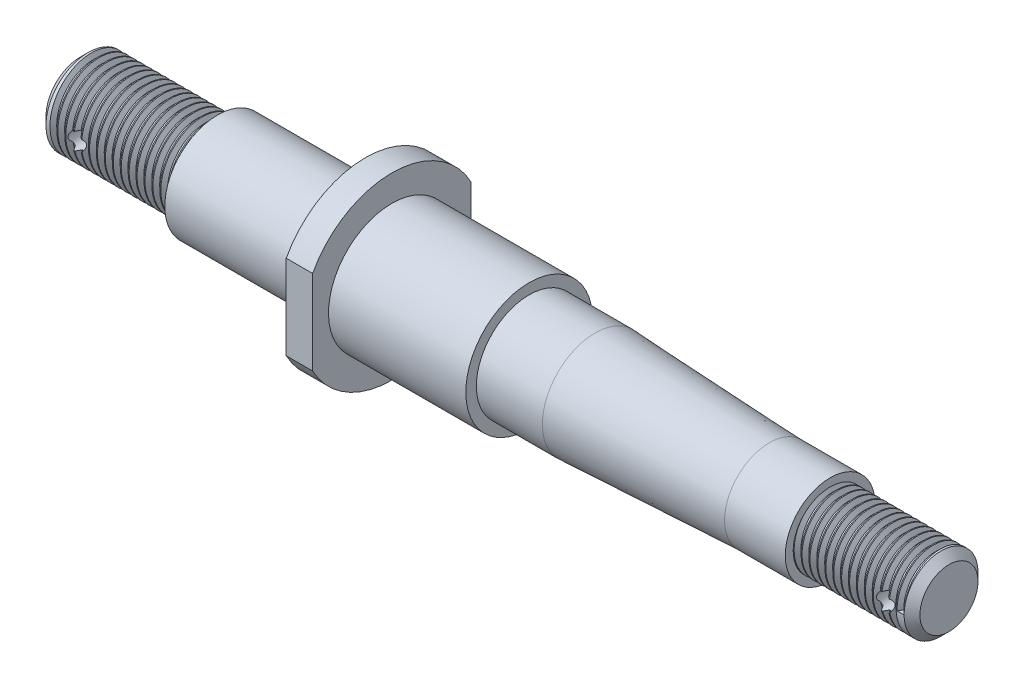
from build123d import *
from build123d.topology import SkipClean

# Parameters (mm, degrees)
THREAD1_PITCH           = 1.5
THREAD2_PITCH           = 1.5
SKETCH12_W              = 5.170014344
SKETCH12_H              = 32.773424437
SKETCH12_W_2            = 5.397924111
SKETCH12_H_2            = 31.861785371
CUT_EXTRUDE1_DEPTH      = 167.247556373
CUT_EXTRUDE2_DEPTH      = 10
CUT_EXTRUDE2_DEPTH_BACK = 10
SKETCH14_R              = 1.6


with BuildPart() as part:
    # Sketch2 → Revolve1 (revolve)
    with BuildSketch(Plane.XY):
        Polygon((-54, 0), (-54, 6.5), (-52.5, 8), (-28, 8), (-28, 10), (0, 10), (0, 17), (5, 17), (5, 12), (31, 12), (31, 10), (43.5, 10), (76.5, 8.5), (88, 8.5), (88, 7), (109, 7), (110.5, 5.5), (110.5, 0), align=None)
    revolve(axis=Axis((110.5, 0, 0), (-1, 0, 0)))

    # Thread1: arcs per turn and ends read off the stored shape
    # Thread1: the profile of Thread Profile2 profile screwed along a right-hand helix through 16.333333 turns, 8 arcs to a turn; built about Z, then put on its axis
    with SkipClean():  # the faces are left unmerged after this step: merging them gives an invalid solid
        thread1_z = Axis((0, 0, 0), (0, 0, 1))
        thread1_corners = [(8.0003, 0, -0.000173205), (8.0003, 0, 1.312673201), (7.188101188, 0, 0.843749998), (7.188101188, 0, 0.468749998)]
        with BuildLine(mode=Mode.PRIVATE) as thread1_profile:
            Line(thread1_corners[0], thread1_corners[1])
            Line(thread1_corners[1], thread1_corners[2])
            Line(thread1_corners[2], thread1_corners[3])
            Line(thread1_corners[3], thread1_corners[0])
        thread1_cap = Face(thread1_profile.wire())
        thread1_turn_angles = [0, 22.5, 45, 67.5, 90, 112.5, 135, 157.5, 180, 202.5, 225, 247.5, 270, 292.5, 315, 337.5, 360]
        thread1_turn_weights = [1, 0.9238795325112867, 1, 0.9238795325112867, 1, 0.9238795325112867, 1, 0.9238795325112867, 1, 0.9238795325112867, 1, 0.9238795325112867, 1, 0.9238795325112867, 1, 0.9238795325112867, 1]
        thread1_turn_rails = [Edge.make_bspline([Vector(p[0], p[1], 0).rotate(thread1_z, thread1_turn_angles[k]) / thread1_turn_weights[k] + Vector(0, 0, p[2] + THREAD1_PITCH * thread1_turn_angles[k] / 360) for k in range(17)], [0, 0, 0, 1, 1, 2, 2, 3, 3, 4, 4, 5, 5, 6, 6, 7, 7, 8, 8, 8], 2, thread1_turn_weights) for p in thread1_corners]
        thread1_turn_sides = [Face.make_surface_from_curves(thread1_turn_rails[p[0]], thread1_turn_rails[p[1]]) for p in [(0, 1), (1, 2), (2, 3), (3, 0)]]
        thread1_last_angles = [5760, 5782.5, 5805, 5827.5, 5850, 5865, 5880]
        thread1_last_weights = [1, 0.9238795325112867, 1, 0.9238795325112867, 1, 0.9659258262890601, 1]
        thread1_last_rails = [Edge.make_bspline([Vector(p[0], p[1], 0).rotate(thread1_z, thread1_last_angles[k]) / thread1_last_weights[k] + Vector(0, 0, p[2] + THREAD1_PITCH * thread1_last_angles[k] / 360) for k in range(7)], [0, 0, 0, 1, 1, 2, 2, 3, 3, 3], 2, thread1_last_weights) for p in thread1_corners]
        thread1_last_sides = [Face.make_surface_from_curves(thread1_last_rails[p[0]], thread1_last_rails[p[1]]) for p in [(0, 1), (1, 2), (2, 3), (3, 0)]]
        thread1 = Plane(origin=(-52.5, 0, 0), x_dir=(0, 0, -1), z_dir=(1, 0, 0)) * Solid(Shell([*[p.moved(Location((0, 0, THREAD1_PITCH * i))) for i in range(16) for p in thread1_turn_sides], *thread1_last_sides, thread1_cap, thread1_cap.rotate(thread1_z, 5880).moved(Location((0, 0, THREAD1_PITCH * 5880 / 360)))]))
        add(thread1, mode=Mode.SUBTRACT)

    # Thread2: arcs per turn and ends read off the stored shape
    # Thread2: the profile of Thread Profile3 profile screwed along a right-hand helix through 14 turns, 8 arcs to a turn; built about Z, then put on its axis
    with SkipClean():  # the faces are left unmerged after this step: merging them gives an invalid solid
        thread2_z = Axis((0, 0, 0), (0, 0, 1))
        thread2_corners = [(7.0003, 0, -0.000173205), (7.0003, 0, 1.312673201), (6.188101188, 0, 0.843749998), (6.188101188, 0, 0.468749998)]
        with BuildLine(mode=Mode.PRIVATE) as thread2_profile:
            Line(thread2_corners[0], thread2_corners[1])
            Line(thread2_corners[1], thread2_corners[2])
            Line(thread2_corners[2], thread2_corners[3])
            Line(thread2_corners[3], thread2_corners[0])
        thread2_cap = Face(thread2_profile.wire())
        thread2_turn_angles = [0, 22.5, 45, 67.5, 90, 112.5, 135, 157.5, 180, 202.5, 225, 247.5, 270, 292.5, 315, 337.5, 360]
        thread2_turn_weights = [1, 0.9238795325112867, 1, 0.9238795325112867, 1, 0.9238795325112867, 1, 0.9238795325112867, 1, 0.9238795325112867, 1, 0.9238795325112867, 1, 0.9238795325112867, 1, 0.9238795325112867, 1]
        thread2_turn_rails = [Edge.make_bspline([Vector(p[0], p[1], 0).rotate(thread2_z, thread2_turn_angles[k]) / thread2_turn_weights[k] + Vector(0, 0, p[2] + THREAD2_PITCH * thread2_turn_angles[k] / 360) for k in range(17)], [0, 0, 0, 1, 1, 2, 2, 3, 3, 4, 4, 5, 5, 6, 6, 7, 7, 8, 8, 8], 2, thread2_turn_weights) for p in thread2_corners]
        thread2_turn_sides = [Face.make_surface_from_curves(thread2_turn_rails[p[0]], thread2_turn_rails[p[1]]) for p in [(0, 1), (1, 2), (2, 3), (3, 0)]]
        thread2 = Plane(origin=(109, 0, 0), x_dir=(0, 0, 1), z_dir=(-1, 0, 0)) * Solid(Shell([*[p.moved(Location((0, 0, THREAD2_PITCH * i))) for i in range(14) for p in thread2_turn_sides], thread2_cap, thread2_cap.rotate(thread2_z, 5040).moved(Location((0, 0, THREAD2_PITCH * 5040 / 360)))]))
        add(thread2, mode=Mode.SUBTRACT)

    # Sketch12 → Cut-Extrude1 (cut, through all)
    with SkipClean():  # the faces are left unmerged after this step: merging them gives an invalid solid
        with BuildSketch(Plane(origin=(110.5, 0, 0), x_dir=(0, 0, -1), z_dir=(1, 0, 0))):
            with Locations((-17.585007172, -2.529798409)):
                Rectangle(SKETCH12_W, SKETCH12_H)
            with Locations((17.698962056, -2.985617943)):
                Rectangle(SKETCH12_W_2, SKETCH12_H_2)
        extrude(amount=-CUT_EXTRUDE1_DEPTH, mode=Mode.SUBTRACT)

    # Sketch14 → Cut-Extrude2 (cut, two sides: drawn at the far end of the back side and taken through both)
    with SkipClean():  # the faces are left unmerged after this step: merging them gives an invalid solid
        with BuildSketch(Plane.XY.offset(-CUT_EXTRUDE2_DEPTH_BACK)):
            with Locations(Location((105, 0, 0), (0, 0, 149.213437038))):
                Circle(SKETCH14_R)
            with Locations(Location((-47, 0, 0), (0, 0, 145.016119319))):
                Circle(SKETCH14_R)
        extrude(amount=CUT_EXTRUDE2_DEPTH + CUT_EXTRUDE2_DEPTH_BACK, mode=Mode.SUBTRACT)


solid = part.part
